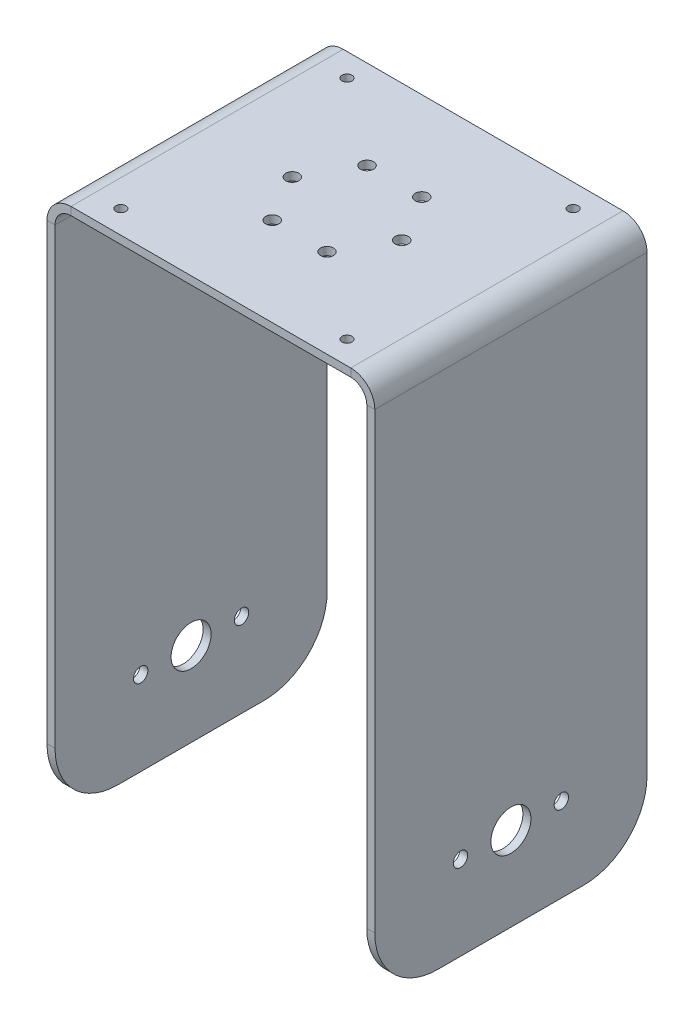
from build123d import *

# Parameters (mm, degrees)
SKETCH3_W                    = 130
SKETCH3_H                    = 107.95
BASE_FLANGE1_DEPTH           = 3.175
EDGE_FLANGE1_STRIP_W         = 25.4
EDGE_FLANGE1_STRIP_H         = 3.175
EDGE_FLANGE1_STRIP_CUT_DEPTH = 107.95
EDGE_FLANGE1_DEPTH           = 107.95
EDGE_FLANGE1_PROFILE_W       = 107.95
EDGE_FLANGE1_PROFILE_H       = 204.7875
EDGE_FLANGE1_PROFILE_R       = 2.855235605
EDGE_FLANGE1_PROFILE_R_2     = 7.9375
EDGE_FLANGE1_FLAT_DEPTH      = 3.175
FILLET1_R                    = 25
SKETCH13_R                   = 2.6
FLANGE_COUPLING_HOLES_DEPTH  = 231.365249726
SKETCH15_R                   = 1.985
CUT_EXTRUDE1_DEPTH           = 231.365249726


# Sheet-metal steps are written as plain solids
with BuildPart() as part:
    # Sketch3 → Base-Flange1 (new body)
    with BuildSketch(Plane(origin=(0, 0, 0), x_dir=(1, 0, 0), z_dir=(0, 1, 0))):
        Rectangle(SKETCH3_W, SKETCH3_H)
    extrude(amount=-BASE_FLANGE1_DEPTH)

    # Edge-Flange1 strip (across the edge) → Edge-Flange1 strip cut (cut)
    with BuildSketch(Plane(origin=(65, -3.175, -53.975), x_dir=(-1, 0, 0), z_dir=(0, 0, 1))):
        with Locations((-3.175, -1.5875)):
            Rectangle(EDGE_FLANGE1_STRIP_W, EDGE_FLANGE1_STRIP_H)
    edge_flange1_strip_cut = extrude(amount=EDGE_FLANGE1_STRIP_CUT_DEPTH, mode=Mode.SUBTRACT)

    # Edge-Flange1 bend section (across the edge) → Edge-Flange1 (add)
    with BuildSketch(Plane(origin=(65, -3.175, -53.975), x_dir=(-1, 0, 0), z_dir=(0, 0, 1))):
        with BuildLine():
            Line((0, 6.35), (3.175, 6.35))
            ThreePointArc((3.175, 6.35), (5.034871939, 1.859871939), (9.525, 0))
            Line((9.525, 0), (9.525, -3.175))
            ThreePointArc((9.525, -3.175), (2.789807909, -0.385192091), (0, 6.35))
        make_face()
    edge_flange1 = extrude(amount=EDGE_FLANGE1_DEPTH)

    # Edge-Flange1 profile (on flange) → Edge-Flange1 flat (add)
    with BuildSketch(Plane(origin=(65, -3.175, 0), x_dir=(0, 0, -1), z_dir=(-1, 0, 0))):
        with Locations((0, 108.74375)):
            Rectangle(EDGE_FLANGE1_PROFILE_W, EDGE_FLANGE1_PROFILE_H)
        with Locations((20, 177.8)):
            Circle(EDGE_FLANGE1_PROFILE_R, mode=Mode.SUBTRACT)
        with Locations((0, 177.8)):
            Circle(EDGE_FLANGE1_PROFILE_R_2, mode=Mode.SUBTRACT)
        with Locations((-20, 177.8)):
            Circle(EDGE_FLANGE1_PROFILE_R, mode=Mode.SUBTRACT)
    edge_flange1_flat = extrude(amount=EDGE_FLANGE1_FLAT_DEPTH)

    # Mirror1: Edge-Flange1 strip cut, Edge-Flange1, Edge-Flange1 flat across plane
    add(edge_flange1_strip_cut.mirror(Plane(origin=(0, 0, 0), x_dir=(0, 0, 1), z_dir=(1, 0, 0))), mode=Mode.SUBTRACT)
    add(edge_flange1.mirror(Plane(origin=(0, 0, 0), x_dir=(0, 0, 1), z_dir=(1, 0, 0))))
    add(edge_flange1_flat.mirror(Plane(origin=(0, 0, 0), x_dir=(0, 0, 1), z_dir=(1, 0, 0))))

    # Fillet1
    fillet1_edges = [part.edges().sort_by_distance(p)[0] for p in [
        (-63.4125, -214.3125, -53.975),
        (63.4125, -214.3125, -53.975),
        (63.4125, -214.3125, 53.975),
        (-63.4125, -214.3125, 53.975),
    ]]
    fillet(fillet1_edges, radius=FILLET1_R)

    # Sketch13 → Flange Coupling Holes (cut, through all)
    with BuildSketch(Plane(origin=(0, 0, 0), x_dir=(1, 0, 0), z_dir=(0, 1, 0))):
        with Locations(Location((-21.7, 0, 0), (0, 0, 270))):
            Circle(SKETCH13_R)
        with Locations(Location((-10.85, 18.792751262, 0), (0, 0, 270))):
            Circle(SKETCH13_R)
        with Locations(Location((10.85, 18.792751262, 0), (0, 0, 270))):
            Circle(SKETCH13_R)
        with Locations(Location((21.7, 0, 0), (0, 0, 270))):
            Circle(SKETCH13_R)
        with Locations(Location((10.85, -18.792751262, 0), (0, 0, 270))):
            Circle(SKETCH13_R)
        with Locations(Location((-10.85, -18.792751262, 0), (0, 0, 270))):
            Circle(SKETCH13_R)
    extrude(amount=-FLANGE_COUPLING_HOLES_DEPTH, mode=Mode.SUBTRACT)

    # Sketch15 → Cut-Extrude1 (cut, through all)
    with BuildSketch(Plane(origin=(0, 0, 0), x_dir=(1, 0, 0), z_dir=(0, 1, 0))):
        with Locations(Location((-44.845, 44.845, 0), (0, 0, 270))):
            Circle(SKETCH15_R)
        with Locations(Location((44.845, 44.845, 0), (0, 0, 270))):
            Circle(SKETCH15_R)
        with Locations(Location((44.845, -44.845, 0), (0, 0, 270))):
            Circle(SKETCH15_R)
        with Locations(Location((-44.845, -44.845, 0), (0, 0, 270))):
            Circle(SKETCH15_R)
    extrude(amount=-CUT_EXTRUDE1_DEPTH, mode=Mode.SUBTRACT)


solid = part.part
